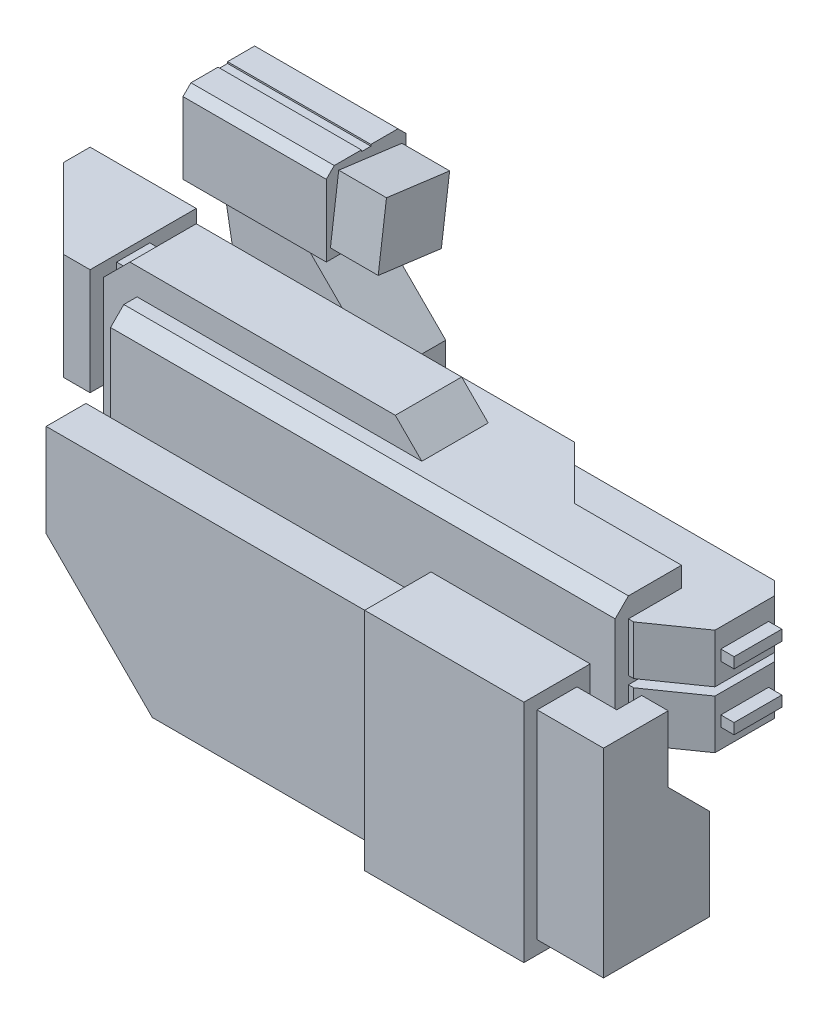
from build123d import *

# Parameters (mm, degrees)
BOSS_EXTRUDE1_DEPTH       = 10.16
BOSS_EXTRUDE2_DEPTH       = 5.08
BOSS_EXTRUDE2_DEPTH_BACK  = 17.78
CHAMFER1_SIZE             = 1.27
BOSS_EXTRUDE3_DEPTH       = 7.62
CUT_EXTRUDE1_DEPTH        = 0.254
SCALE1_SCALE              = 0.6
CHAMFER3_SIZE             = 24.13
CHAMFER3_SIZE_2           = 4.254770044
BOSS_EXTRUDE7_DEPTH       = 6.35
CHAMFER4_SIZE             = 2.54
SKETCH9_W                 = 10.985229955
SKETCH9_H                 = 6.096
SKETCH9_W_2               = 4.255191267
CUT_EXTRUDE4_DEPTH        = 1.27
BOSS_EXTRUDE8_DEPTH       = 63.5
SKETCH12_W                = 0.141876601
SKETCH12_H                = 13.97
SKETCH12_W_2              = 2.398123399
CUT_EXTRUDE7_DEPTH        = 2.54
CHAMFER5_SIZE             = 1.27
SKETCH14_W                = 3.81
SKETCH14_H                = 7.62
BOSS_EXTRUDE9_DEPTH       = 1.27
SKETCH15_W                = 3.81
SKETCH15_H                = 7.62
BOSS_EXTRUDE10_DEPTH      = 10.16
SKETCH16_W                = 1.27
SKETCH16_H                = 7.62
CUT_EXTRUDE8_DEPTH        = 0.635
SKETCH17_W                = 1.27
SKETCH17_H                = 3.175
CUT_EXTRUDE9_DEPTH        = 0.635
CHAMFER6_SIZE             = 7.62
BOSS_EXTRUDE11_DEPTH      = 6.35
SKETCH19_W                = 43.866481186
SKETCH19_H                = 13.97
BOSS_EXTRUDE12_DEPTH      = 10.16
CHAMFER7_SIZE             = 1.27
SKETCH20_W                = 12.665631385
SKETCH20_H                = 5.08
SKETCH20_H_2              = 1.237744284
CUT_EXTRUDE12_DEPTH       = 17.78
SKETCH6_W                 = 7.62
SKETCH6_H                 = 7.62
BOSS_EXTRUDE13_DEPTH      = 1.27
SKETCH21_W                = 12.665631385
SKETCH21_H                = 6.35
CUT_EXTRUDE14_DEPTH       = 17.78
CUT_EXTRUDE15_DEPTH       = 17.78
BOSS_EXTRUDE14_DEPTH      = 2.54
SKETCH25_W                = 3.81
SKETCH25_H                = 19.05
BOSS_EXTRUDE15_DEPTH      = 50.8
CHAMFER8_SIZE             = 10.16
SKETCH26_W                = 45.754368615
SKETCH26_H                = 3.880635149
BOSS_EXTRUDE18_DEPTH      = 5.08
BOSS_EXTRUDE19_DEPTH      = 1.27
BOSS_EXTRUDE19_DEPTH_BACK = 5.08
SKETCH27_W                = 15.24
SKETCH27_H                = 19.05
SKETCH27_H_2              = 1.27
SKETCH28_W                = 10.16
SKETCH28_H                = 1.27
BOSS_EXTRUDE20_DEPTH      = 2.54
SKETCH29_W                = 20.32
SKETCH29_H                = 7.62
BOSS_EXTRUDE21_DEPTH      = 7.62
CHAMFER9_SIZE             = 5.08
SKETCH30_W                = 7.62
SKETCH30_H                = 7.62
BOSS_EXTRUDE22_DEPTH      = 3.81
BOSS_EXTRUDE24_DEPTH      = 5.08
BOSS_EXTRUDE24_DEPTH_BACK = 20.32
SKETCH31_W                = 5.08
SKETCH31_H                = 10.16
SKETCH32_W                = 10.16
SKETCH32_H                = 0.762
CUT_EXTRUDE16_DEPTH       = 5.08
SKETCH33_W                = 5.08
SKETCH33_H                = 0.762
CUT_EXTRUDE17_DEPTH       = 15.24
CHAMFER10_SIZE            = 4.572
CHAMFER10_SIZE2           = 3.201348865
CHAMFER11_SIZE            = 3.201348865
CHAMFER11_SIZE2           = 4.572
CHAMFER12_SIZE            = 1.27
BOSS_EXTRUDE25_DEPTH      = 1.27


with BuildPart() as part:
    # Sketch1 → Boss-Extrude1 (new body)
    with BuildSketch(Plane.XY):
        Polygon((0, 0), (0, 25.4), (12.7, 25.4), (25.4, 12.7), (25.4, 0), (25.4, -12.7), (0, -12.7), align=None)
    extrude(amount=BOSS_EXTRUDE1_DEPTH)

    # Sketch2 → Boss-Extrude2 (add, two sides: drawn at the far end of the back side and taken through both)
    with BuildSketch(Plane.ZY.offset(-BOSS_EXTRUDE2_DEPTH_BACK)):
        Polygon((5.08, 25.4), (11.43, 25.4), (11.43, 38.1), (-1.27, 38.1), (-1.27, 25.4), align=None)
    extrude(amount=BOSS_EXTRUDE2_DEPTH + BOSS_EXTRUDE2_DEPTH_BACK)

    # Chamfer1
    chamfer1_edges = [part.edges().sort_by_distance(p)[0] for p in [
        (6.35, 38.1, 11.43),
        (6.35, 38.1, -1.27),
    ]]
    chamfer(chamfer1_edges, length=CHAMFER1_SIZE)

    # Sketch3 → Boss-Extrude3 (add)
    with BuildSketch(Plane(origin=(17.78, 0, 0), x_dir=(0, 0, -1), z_dir=(1, 0, 0))):
        Polygon((-10.772282393, 27.027673315), (-9.451047753, 37.101398496), (0.622677429, 35.780163856), (-0.698557212, 25.706438674), align=None)
    extrude(amount=BOSS_EXTRUDE3_DEPTH)

    # Sketch4 → Cut-Extrude1 (cut)
    with BuildSketch(Plane(origin=(0, 38.1, 0), x_dir=(1, 0, 0), z_dir=(0, 1, 0))):
        Polygon((-5.08, -5.842), (17.78, -5.842), (17.78, -4.318), (-5.08, -4.318), (-5.08, -5.08), align=None)
    extrude(amount=-CUT_EXTRUDE1_DEPTH, mode=Mode.SUBTRACT)


with BuildPart() as part_1:
    # Scale1: scaled about (10.983797036, 13.773944281, 5.079695833)
    add(part.part.scale(SCALE1_SCALE).moved(Location((4.393518814, 5.509577712, 2.031878333))))

    # Chamfer3
    # the kernel refuses this chamfer: 24.13, 4.254770044 mm, written as the material it takes off along each edge
    with BuildSketch(Plane(origin=(4.393518814, -2.110422288, -60.670862824), x_dir=(-0.006682531656101754, 0.9999776716360547, 0), z_dir=(0, 0, 1))) as chamfer3_piece_1_section:
        Polygon((CHAMFER3_SIZE * 0.999977671636, -CHAMFER3_SIZE * 0.0066825316561), (-CHAMFER3_SIZE_2 * 0.00668253165688, -CHAMFER3_SIZE_2 * 0.999977671752), (0, 0), align=None)
    chamfer3_piece_1 = extrude(amount=131.501482315, mode=Mode.PRIVATE)
    chamfer3_piece_1 = split(chamfer3_piece_1, bisect_by=Plane(origin=(5.574307044, 20.749577712, 5.079878333), z_dir=(0, -1, 0)), keep=Keep.TOP, mode=Mode.PRIVATE)
    add(chamfer3_piece_1, mode=Mode.SUBTRACT)

    # Sketch8 → Boss-Extrude7 (add)
    with BuildSketch(Plane.XY.offset(8.127878333)):
        Polygon((19.633518814, -2.110422288), (29.793518814, -2.110422288), (29.793518814, 16.939577712), (-0.686481186, 16.939577712), (-0.686481186, -2.110422288), align=None)
    extrude(amount=BOSS_EXTRUDE7_DEPTH)

    # Chamfer4
    chamfer4_edges = [part_1.edges().sort_by_distance(p)[0] for p in [
        (-0.686481186, -2.110422288, 11.302878333),
        (29.793518814, -2.110422288, 11.302878333),
        (29.793518814, 16.939577712, 11.302878333),
        (-0.686481186, 16.939577712, 11.302878333),
    ]]
    chamfer(chamfer4_edges, length=CHAMFER4_SIZE)

    # Sketch9 → Cut-Extrude4 (cut)
    with BuildSketch(Plane.XZ.offset(2.110422288)):
        with Locations((14.140903837, 5.079878333)):
            Rectangle(SKETCH9_W, SKETCH9_H)
        with Locations((6.520693226, 5.079878333)):
            Rectangle(SKETCH9_W_2, SKETCH9_H)
    extrude(amount=-CUT_EXTRUDE4_DEPTH, mode=Mode.SUBTRACT)

    # Sketch10 → Boss-Extrude8 (add)
    with BuildSketch(Plane.ZY):
        Polygon((14.477878333, 14.399577712), (14.477878333, 0.429577712), (17.017878333, 0.429577712), (17.017878333, 14.399577712), (14.861111331, 14.399577712), align=None)
    extrude(amount=-BOSS_EXTRUDE8_DEPTH)

    # Sketch12 → Cut-Extrude7 (cut)
    with BuildSketch(Plane.ZY):
        with Locations((14.548816634, 7.414577712)):
            Rectangle(SKETCH12_W, SKETCH12_H)
        with Locations((15.818816634, 7.414577712)):
            Rectangle(SKETCH12_W_2, SKETCH12_H)
    extrude(amount=-CUT_EXTRUDE7_DEPTH, mode=Mode.SUBTRACT)

    # Chamfer5
    chamfer5_edges = [part_1.edges().sort_by_distance(p)[0] for p in [
        (33.02, 14.399577712, 17.017878333),
        (33.02, 0.429577712, 17.017878333),
    ]]
    chamfer(chamfer5_edges, length=CHAMFER5_SIZE)

    # Sketch14 → Boss-Extrude9 (add)
    with BuildSketch(Plane.ZY.offset(0.686481186)):
        with Locations((10.032878333, 10.589577712)):
            Rectangle(SKETCH14_W, SKETCH14_H)
    extrude(amount=BOSS_EXTRUDE9_DEPTH)

    # Sketch15 → Boss-Extrude10 (add)
    with BuildSketch(Plane.ZY.offset(1.956481186)):
        Polygon((11.937878333, 4.200697775), (11.937878333, 6.779577712), (8.127878333, 6.779577712), (8.127878333, 14.399577712), (4.317878333, 14.399577712), (4.317878333, 4.200697775), align=None)
        with Locations((10.032878333, 10.589577712)):
            Rectangle(SKETCH15_W, SKETCH15_H)
        Polygon((14.477878333, 14.399577712), (14.477878333, 4.200697775), (11.937878333, 4.200697775), (11.937878333, 6.779577712), (11.937878333, 14.399577712), align=None)
    extrude(amount=BOSS_EXTRUDE10_DEPTH)

    # Sketch16 → Cut-Extrude8 (cut)
    with BuildSketch(Plane(origin=(0, 0, 8.127878333), x_dir=(-1, 0, 0), z_dir=(0, 0, -1))):
        with Locations((1.321481186, 10.589577712)):
            Rectangle(SKETCH16_W, SKETCH16_H)
    extrude(amount=-CUT_EXTRUDE8_DEPTH, mode=Mode.SUBTRACT)

    # Sketch17 → Cut-Extrude9 (cut)
    with BuildSketch(Plane(origin=(0, 14.399577712, 0), x_dir=(1, 0, 0), z_dir=(0, 1, 0))):
        with Locations((-1.321481186, -10.350378333)):
            Rectangle(SKETCH17_W, SKETCH17_H)
    extrude(amount=-CUT_EXTRUDE9_DEPTH, mode=Mode.SUBTRACT)

    # Chamfer6
    chamfer6_edges = [part_1.edges().sort_by_distance(p)[0] for p in [
        (-12.116481186, 9.300137744, 14.477878333),
    ]]
    chamfer(chamfer6_edges, length=CHAMFER6_SIZE)

    # Sketch18 → Boss-Extrude11 (add)
    with BuildSketch(Plane(origin=(0, 0, 8.127878333), x_dir=(-1, 0, 0), z_dir=(0, 0, -1))):
        Polygon((-27.253518814, -2.110422288), (-29.793518814, 0.429577712), (-29.793518814, -2.110422288), align=None)
    extrude(amount=-BOSS_EXTRUDE11_DEPTH)

    # Sketch19 → Boss-Extrude12 (add)
    with BuildSketch(Plane(origin=(0, 0, 14.477878333), x_dir=(-1, 0, 0), z_dir=(0, 0, -1))):
        with Locations((-41.566759407, 7.414577712)):
            Rectangle(SKETCH19_W, SKETCH19_H)
    extrude(amount=BOSS_EXTRUDE12_DEPTH)

    # Chamfer7
    chamfer7_edges = [part_1.edges().sort_by_distance(p)[0] for p in [
        (41.566759407, 14.399577712, 4.317878333),
        (41.566759407, 0.429577712, 4.317878333),
    ]]
    chamfer(chamfer7_edges, length=CHAMFER7_SIZE)

    # Sketch20 → Cut-Extrude12 (cut)
    with BuildSketch(Plane(origin=(0, 14.399577712, 0), x_dir=(1, 0, 0), z_dir=(0, 1, 0))):
        Polygon((63.5, -1.736490395), (63.5, -4.350134049), (50.834368615, -4.350134049), (44.484368615, -4.350134049), (41.857380808, -1.736490395), align=None)
        with Locations((57.167184308, -8.127878333)):
            Rectangle(SKETCH20_W, SKETCH20_H)
        Polygon((50.834368615, -4.350134049), (44.484368615, -4.350134049), (45.728432296, -5.587878333), (50.834368615, -5.587878333), align=None)
        Polygon((50.834368615, -5.587878333), (45.728432296, -5.587878333), (50.834368615, -10.667878333), align=None)
        with Locations((57.167184308, -4.969006191)):
            Rectangle(SKETCH20_W, SKETCH20_H_2)
    extrude(amount=-CUT_EXTRUDE12_DEPTH, mode=Mode.SUBTRACT)

    # Sketch6 → Boss-Extrude13 (add)
    with BuildSketch(Plane(origin=(0, 0, 2.031878333), x_dir=(-1, 0, 0), z_dir=(0, 0, -1))):
        with Locations((-12.013518814, 10.589577712)):
            Rectangle(SKETCH6_W, SKETCH6_H)
    extrude(amount=BOSS_EXTRUDE13_DEPTH)

    # Sketch21 → Cut-Extrude14 (cut)
    with BuildSketch(Plane(origin=(0, 14.399577712, 0), x_dir=(1, 0, 0), z_dir=(0, 1, 0))):
        with Locations((57.167184308, -13.842878333)):
            Rectangle(SKETCH21_W, SKETCH21_H)
    extrude(amount=-CUT_EXTRUDE14_DEPTH, mode=Mode.SUBTRACT)

    # Sketch22 → Cut-Extrude15 (cut)
    with BuildSketch(Plane(origin=(0, 14.399577712, 0), x_dir=(1, 0, 0), z_dir=(0, 1, 0))):
        Polygon((50.834368615, -10.667878333), (40.604954359, -10.667878333), (33.066219798, -3.129143772), (50.834368615, -3.464094762), align=None)
    extrude(amount=-CUT_EXTRUDE15_DEPTH, mode=Mode.SUBTRACT)



with BuildPart() as body_2:
    # Sketch24 → Boss-Extrude14 (new body)
    with BuildSketch(Plane(origin=(53.374368615, 0, 0), x_dir=(0, 0, -1), z_dir=(1, 0, 0))):
        Polygon((-15.747878333, 0.429577712), (-13.053801497, -2.264499124), (-13.053801497, -11.000422288), (-23.213801497, -11.000422288), (-23.213801497, 8.049577712), (-17.017878333, 8.049577712), (-17.017878333, 1.699577712), align=None)
    extrude(amount=BOSS_EXTRUDE14_DEPTH)

    # Sketch25 → Boss-Extrude15 (add)
    with BuildSketch(Plane.ZY.offset(-53.374368615)):
        with Locations((21.308801497, -1.475422288)):
            Rectangle(SKETCH25_W, SKETCH25_H)
    extrude(amount=BOSS_EXTRUDE15_DEPTH)

    # Chamfer8
    chamfer8_edges = [body_2.edges().sort_by_distance(p)[0] for p in [
        (2.574368615, -11.000422288, 21.308801497),
    ]]
    chamfer(chamfer8_edges, length=CHAMFER8_SIZE)


with BuildPart() as part_2:
    add(part_1.part)

    add(body_2.part)  # Boss-Extrude18 merges body 2
    # Sketch26 → Boss-Extrude18 (add)
    with BuildSketch(Plane.XY.offset(17.017878333)):
        with Locations((27.957184308, 3.639895287)):
            Rectangle(SKETCH26_W, SKETCH26_H)
    extrude(amount=BOSS_EXTRUDE18_DEPTH)

    # Sketch27 → Boss-Extrude19 (add, two sides: drawn at the far end of the back side and taken through both)
    with BuildSketch(Plane.XY.offset(23.213801497).offset(-BOSS_EXTRUDE19_DEPTH_BACK)):
        with Locations((41.944368615, -1.475422288)):
            Rectangle(SKETCH27_W, SKETCH27_H)
        with Locations((41.944368615, 8.684577712)):
            Rectangle(SKETCH27_W, SKETCH27_H_2)
        with Locations((41.944368615, -11.635422288)):
            Rectangle(SKETCH27_W, SKETCH27_H_2)
    extrude(amount=BOSS_EXTRUDE19_DEPTH + BOSS_EXTRUDE19_DEPTH_BACK)

    # Sketch28 → Boss-Extrude20 (add)
    with BuildSketch(Plane.XZ.offset(2.110422288)):
        with Locations((15.823518814, 11.937878333)):
            Rectangle(SKETCH28_W, SKETCH28_H)
        with Locations((15.823518814, 10.667878333)):
            Rectangle(SKETCH28_W, SKETCH28_H)
    extrude(amount=BOSS_EXTRUDE20_DEPTH)

    # Sketch29 → Boss-Extrude21 (add)
    with BuildSketch(Plane(origin=(0, -4.650422288, 0), x_dir=(-1, 0, 0), z_dir=(0, -1, 0))):
        with Locations((-15.823518814, -11.302878333)):
            Rectangle(SKETCH29_W, SKETCH29_H)
    extrude(amount=BOSS_EXTRUDE21_DEPTH)

    # Chamfer9
    chamfer9_edges = [part_2.edges().sort_by_distance(p)[0] for p in [
        (25.983518814, -12.270422288, 11.302878333),
    ]]
    chamfer(chamfer9_edges, length=CHAMFER9_SIZE)

    # Sketch30 → Boss-Extrude22 (add)
    with BuildSketch(Plane.ZY.offset(-5.663518814)):
        Polygon((7.492878333, -13.032422288), (7.492878333, -12.270422288), (7.492878333, -4.650422288), (15.112878333, -4.650422288), (15.112878333, -3.888422288), (6.730878333, -3.888422288), (6.730878333, -13.032422288), align=None)
        Polygon((15.112878333, -12.270422288), (7.492878333, -12.270422288), (7.492878333, -13.032422288), (15.874878333, -13.032422288), (15.874878333, -3.888422288), (15.112878333, -3.888422288), (15.112878333, -4.650422288), align=None)
        with Locations((11.302878333, -8.460422288)):
            Rectangle(SKETCH30_W, SKETCH30_H)
    extrude(amount=BOSS_EXTRUDE22_DEPTH)

    # Sketch31 → Boss-Extrude24 (add, two sides: drawn at the far end of the back side and taken through both)
    with BuildSketch(Plane(origin=(50.834368615, 0, 0), x_dir=(0, 0, -1), z_dir=(1, 0, 0)).offset(-BOSS_EXTRUDE24_DEPTH_BACK)):
        with Locations((-8.127878333, 7.414577712)):
            Rectangle(SKETCH31_W, SKETCH31_H)
        with Locations((-13.207878333, 7.414577712)):
            Rectangle(SKETCH31_W, SKETCH31_H)
    extrude(amount=BOSS_EXTRUDE24_DEPTH + BOSS_EXTRUDE24_DEPTH_BACK)

    # Sketch32 → Cut-Extrude16 (cut)
    with BuildSketch(Plane(origin=(55.914368615, 0, 0), x_dir=(0, 0, -1), z_dir=(1, 0, 0))):
        with Locations((-10.667878333, 7.414577712)):
            Rectangle(SKETCH32_W, SKETCH32_H)
    extrude(amount=-CUT_EXTRUDE16_DEPTH, mode=Mode.SUBTRACT)

    # Sketch33 → Cut-Extrude17 (cut)
    with BuildSketch(Plane(origin=(50.834368615, 0, 0), x_dir=(0, 0, -1), z_dir=(1, 0, 0))):
        with Locations((-8.127878333, 7.414577712)):
            Rectangle(SKETCH33_W, SKETCH33_H)
    extrude(amount=-CUT_EXTRUDE17_DEPTH, mode=Mode.SUBTRACT)

    # Chamfer10
    chamfer10_edges = [part_2.edges().sort_by_distance(p)[0] for p in [
        (55.914368615, 4.684077712, 15.747878333),
    ]]
    chamfer10_side = [part_2.faces().sort_by_distance(p)[0] for p in [
        (53.374368615, 4.684077712, 15.747878333),
    ]]
    chamfer(chamfer10_edges, length=CHAMFER10_SIZE, length2=CHAMFER10_SIZE2, reference=chamfer10_side[0])

    # Chamfer11
    chamfer11_edges = [part_2.edges().sort_by_distance(p)[0] for p in [
        (55.914368615, 10.145077712, 15.747878333),
    ]]
    chamfer11_side = [part_2.faces().sort_by_distance(p)[0] for p in [
        (55.914368615, 10.145077712, 10.667878333),
    ]]
    chamfer(chamfer11_edges, length=CHAMFER11_SIZE, length2=CHAMFER11_SIZE2, reference=chamfer11_side[0])

    # Chamfer12
    chamfer12_edges = [part_2.edges().sort_by_distance(p)[0] for p in [
        (55.914368615, 4.684077712, 5.587878333),
        (55.914368615, 10.145077712, 5.587878333),
    ]]
    chamfer(chamfer12_edges, length=CHAMFER12_SIZE)

    # Sketch35 → Boss-Extrude25 (add)
    with BuildSketch(Plane(origin=(55.914368615, 0, 0), x_dir=(0, 0, -1), z_dir=(1, 0, 0))):
        Polygon((-9.087214589, 9.637077712), (-10.317193213, 10.653077712), (-11.988203901, 10.653077712), (-11.988203901, 9.637077712), align=None)
        Polygon((-7.416203901, 10.653077712), (-10.317193213, 10.653077712), (-9.087214589, 9.637077712), (-7.416203901, 9.637077712), align=None)
        Polygon((-7.416203901, 5.192077712), (-10.317193213, 5.192077712), (-9.087214589, 4.176077712), (-7.416203901, 4.176077712), align=None)
        Polygon((-9.087214589, 4.176077712), (-10.317193213, 5.192077712), (-11.988203901, 5.192077712), (-11.988203901, 4.176077712), align=None)
    extrude(amount=BOSS_EXTRUDE25_DEPTH)


solid = part_2.part
